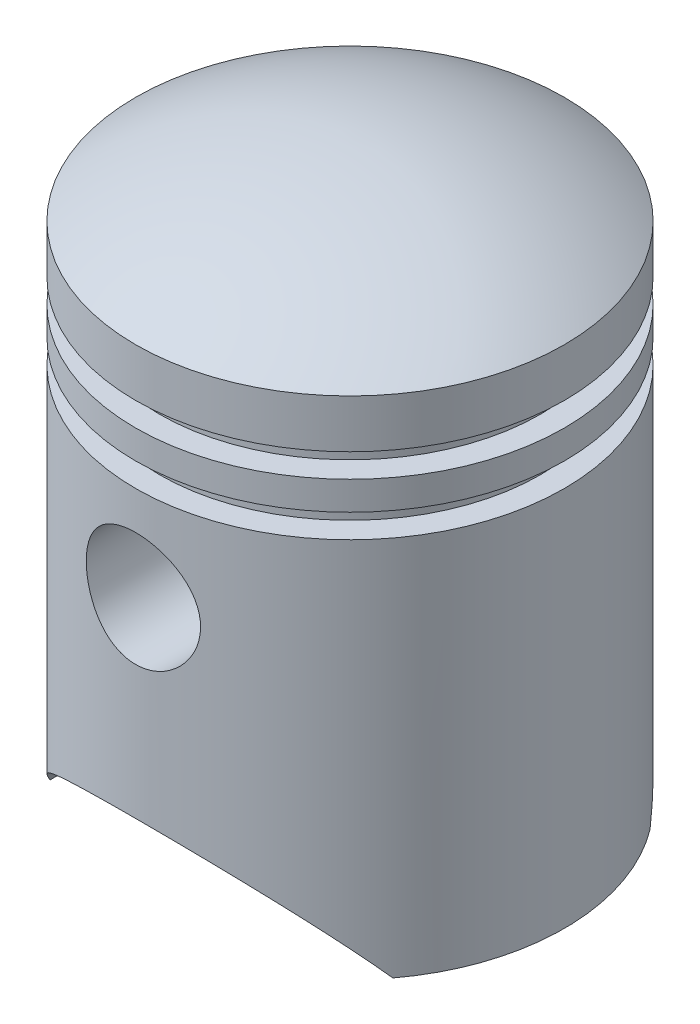
from build123d import *

# Parameters (mm, degrees)
SZKIC2_W                         = 2.5
SZKIC2_H                         = 2.5
SZYK_LINIOWY1_COUNT              = 2
SZYK_LINIOWY1_PITCH              = 5.5
WYTNIJ_WYCI_GNI_CIE1_DEPTH       = 68.915388536
WYTNIJ_WYCI_GNI_CIE1_DEPTH_BACK  = 68.915388536
WYTNIJ_WYCI_GNI_CIE2_DEPTH       = 68.915388602
WYTNIJ_WYCI_GNI_CIE2_DEPTH_BACK  = 68.915388602
SZKIC4_R                         = 6
DODANIE_WYCI_GNI_CIE1_REACH      = 79.915
DODANIE_WYCI_GNI_CIE1_END_RADIUS = 20.5
DODANIE_WYCI_GNI_CIE1_START      = 10
SZKIC5_R                         = 7.5
SZKIC5_R_2                       = 6


# Read off the part's stored shape, not the designer's step: Skorupa1
with BuildPart() as part:
    # Szkic1 → Obrót1 (revolve)
    with BuildSketch(Plane.XY, mode=Mode.PRIVATE) as obr_t1_sk:
        with BuildLine():
            Line((0, 0), (22.5, 0))
            Line((22.5, 0), (22.5, 53.071891388))
            ThreePointArc((22.5, 53.071891388), (11.771243445, 58.228756555), (0, 60))
            Line((0, 60), (0, 0))
        make_face()
    revolve(obr_t1_sk.sketch.rotate(Axis((0, 60, 0), (0, -1, 0)), 180), axis=Axis((0, 60, 0), (0, -1, 0)))

    # Szkic2 → Wycięcie-obrót1 (revolve, cut)
    with BuildSketch(Plane.XY):
        with Locations((21.25, 41.25)):
            Rectangle(SZKIC2_W, SZKIC2_H)
    wyci_cie_obr_t1 = revolve(axis=Axis((0, 43.732823124, 0), (0, 1, 0)), mode=Mode.SUBTRACT)

    # Szyk liniowy1: Wycięcie-obrót1 ×2
    with Locations(*[(0, i * SZYK_LINIOWY1_PITCH, 0) for i in range(1, SZYK_LINIOWY1_COUNT)]):
        add(wyci_cie_obr_t1, mode=Mode.SUBTRACT)

    # Skorupa1 outline → Skorupa1 (revolve, cut)
    with BuildSketch(Plane.XY):
        with BuildLine():
            Line((20.5, 0), (20.5, 38))
            Line((20.5, 38), (18, 38))
            Line((18, 38), (18, 50))
            Line((18, 50), (20.5, 50))
            Line((20.5, 50), (20.500000011, 51.996093505))
            ThreePointArc((20.500000011, 51.996093505), (10.680553516, 56.468147425), (0, 58))
            Line((0, 58), (0, 0))
            Line((0, 0), (20.5, 0))
        make_face()
    revolve(axis=Axis((0, 0, 0), (0, 1, 0)), mode=Mode.SUBTRACT)

    # Szkic3 → Wytnij-wyciągnięcie1 (cut, two sides: drawn at the far end of the back side and taken through both)
    with BuildSketch(Plane.XY.offset(-WYTNIJ_WYCI_GNI_CIE1_DEPTH_BACK)):
        with BuildLine():
            Line((-99.770112831, -131.416252764), (-18, 0))
            ThreePointArc((-18, 0), (0, 10), (18, 0))
            Line((18, 0), (99.770112831, -131.416252764))
            Line((99.770112831, -131.416252764), (99.770112831, -440.974537052))
            Line((99.770112831, -440.974537052), (-99.770112831, -440.974537052))
            Line((-99.770112831, -440.974537052), (-99.770112831, -131.416252764))
        make_face()
    extrude(amount=WYTNIJ_WYCI_GNI_CIE1_DEPTH + WYTNIJ_WYCI_GNI_CIE1_DEPTH_BACK, mode=Mode.SUBTRACT)

    # Szkic4 → Wytnij-wyciągnięcie2 (cut, two sides: drawn at the far end of the back side and taken through both)
    with BuildSketch(Plane.XY.offset(-WYTNIJ_WYCI_GNI_CIE2_DEPTH_BACK)):
        with Locations((0, 30)):
            Circle(SZKIC4_R)
    extrude(amount=WYTNIJ_WYCI_GNI_CIE2_DEPTH + WYTNIJ_WYCI_GNI_CIE2_DEPTH_BACK, mode=Mode.SUBTRACT)

    # Dodanie-wyciągnięcie1: up to this cylinder (the profile starts inside it)
    dodanie_wyci_gni_cie1_end = Plane(origin=(0, 30, 0), z_dir=(0, 1, 0)) * Cylinder(DODANIE_WYCI_GNI_CIE1_END_RADIUS, 201.83, mode=Mode.PRIVATE)
    # Szkic5 → Dodanie-wyciągnięcie1 (add, up to the surface)
    with BuildSketch(Plane.XY.offset(DODANIE_WYCI_GNI_CIE1_START), mode=Mode.PRIVATE) as dodanie_wyci_gni_cie1_sk1:
        with Locations(Location((0, 30, 0), (0, 0, 180))):
            Circle(SZKIC5_R)
        with Locations((0, 30)):
            Circle(SZKIC5_R_2, mode=Mode.SUBTRACT)
    dodanie_wyci_gni_cie1_tool1 = extrude(dodanie_wyci_gni_cie1_sk1.sketch, amount=DODANIE_WYCI_GNI_CIE1_REACH, mode=Mode.PRIVATE) & dodanie_wyci_gni_cie1_end
    dodanie_wyci_gni_cie1 = dodanie_wyci_gni_cie1_tool1.solids().sort_by_distance((7.287868, 30, 10))[0]
    add(dodanie_wyci_gni_cie1)

    # Lustro1: Dodanie-wyciągnięcie1 across plane
    add(dodanie_wyci_gni_cie1.mirror(Plane.XY))


solid = part.part
